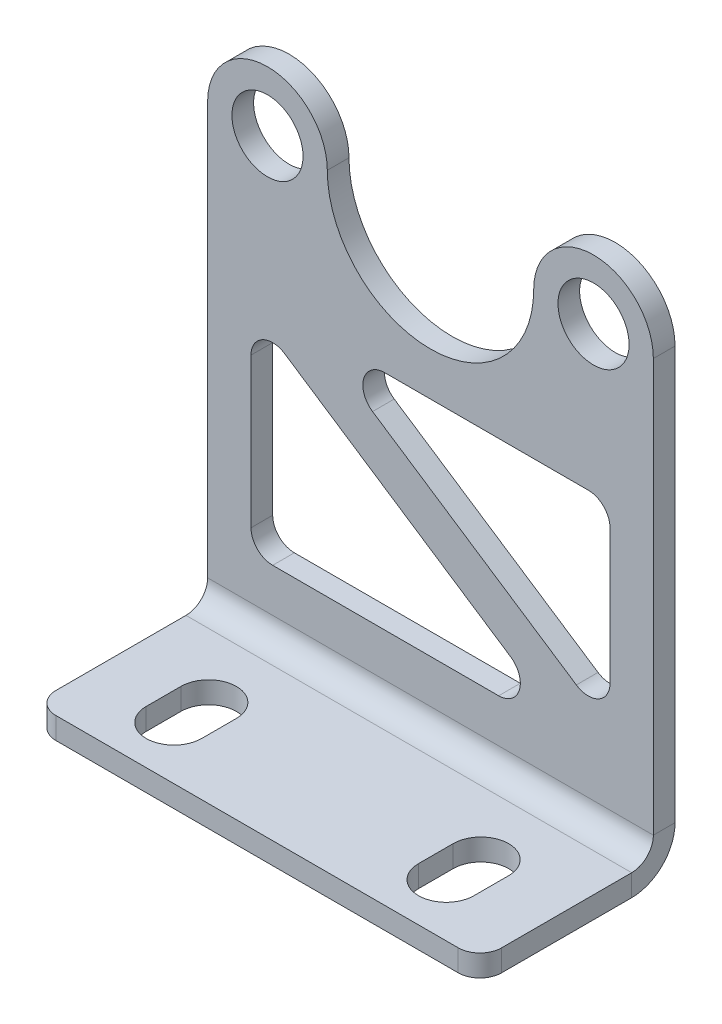
from build123d import *

# Parameters (mm, degrees)
SKETCH1_R              = 5.207
BOSS_EXTRUDE1_DEPTH    = 3.175
SKETCH2_W              = 65.278
SKETCH2_H              = 25.4
BOSS_EXTRUDE2_DEPTH    = 3.175
FILLET1_R              = 3.175
CONVERT_SOLID1_DEPTH   = 65.278
CONVERT_SOLID1_2_DEPTH = 65.278
CUT_EXTRUDE1_DEPTH     = 104.864417073


# Read off the part's stored shape, not the designer's step: Convert-Solid1
with BuildPart() as part:
    # Sketch1 → Boss-Extrude1 (new body)
    with BuildSketch(Plane.XY):
        with BuildLine():
            Line((0, 0), (65.278, 0))
            Line((65.278, 0), (65.278, 66.802))
            ThreePointArc((65.278, 66.802), (56.515, 75.565), (47.752, 66.802))
            ThreePointArc((47.752, 66.802), (32.639, 51.689), (17.526, 66.802))
            ThreePointArc((17.526, 66.802), (8.763, 75.565), (0, 66.802))
            Line((0, 66.802), (0, 0))
        make_face()
        with Locations((8.763, 66.802)):
            Circle(SKETCH1_R, mode=Mode.SUBTRACT)
        with Locations((56.515, 66.802)):
            Circle(SKETCH1_R, mode=Mode.SUBTRACT)
    extrude(amount=BOSS_EXTRUDE1_DEPTH)

    # Sketch2 → Boss-Extrude2 (add)
    with BuildSketch(Plane(origin=(0, 0, 0), x_dir=(1, 0, 0), z_dir=(0, 1, 0))):
        with Locations((32.639, -15.875)):
            Rectangle(SKETCH2_W, SKETCH2_H)
        with BuildLine():
            Line((16.764, -15.73022), (16.764, -20.81022))
            ThreePointArc((16.764, -20.81022), (12.7, -24.87422), (8.636, -20.81022))
            Line((8.636, -20.81022), (8.636, -15.73022))
            ThreePointArc((8.636, -15.73022), (12.7, -11.66622), (16.764, -15.73022))
        make_face(mode=Mode.SUBTRACT)
        with BuildLine():
            Line((48.514, -15.73022), (48.514, -20.81022))
            ThreePointArc((48.514, -20.81022), (52.578, -24.87422), (56.642, -20.81022))
            Line((56.642, -20.81022), (56.642, -15.73022))
            ThreePointArc((56.642, -15.73022), (52.578, -11.66622), (48.514, -15.73022))
        make_face(mode=Mode.SUBTRACT)
    extrude(amount=BOSS_EXTRUDE2_DEPTH)

    # Fillet1
    fillet1_edges = [part.edges().sort_by_distance(p)[0] for p in [
        (0, 1.5875, 28.575),
        (65.278, 1.5875, 28.575),
    ]]
    fillet(fillet1_edges, radius=FILLET1_R)

    # Convert-Solid1 outline → Convert-Solid1 (cut)
    with BuildSketch(Plane.YZ):
        with BuildLine():
            ThreePointArc((6.35, 0), (1.859871939, 1.859871939), (0, 6.35))
            Line((0, 6.35), (0, 0))
            Line((0, 0), (6.35, 0))
        make_face()
    extrude(amount=CONVERT_SOLID1_DEPTH, mode=Mode.SUBTRACT)

    # Convert-Solid1 2 outline → Convert-Solid1 2 (add)
    with BuildSketch(Plane.YZ):
        with BuildLine():
            ThreePointArc((6.35, 3.175), (4.10493597, 4.10493597), (3.175, 6.35))
            Line((3.175, 6.35), (3.175, 3.175))
            Line((3.175, 3.175), (6.35, 3.175))
        make_face()
    extrude(amount=CONVERT_SOLID1_2_DEPTH)

    # Sketch3 → Cut-Extrude1 (cut, through all)
    with BuildSketch(Plane(origin=(0, 0, 0), x_dir=(-1, 0, 0), z_dir=(0, 0, -1))):
        with BuildLine():
            ThreePointArc((-54.001056047, 19.766894808), (-57.256030763, 19.618085357), (-58.928, 22.41478404))
            Line((-58.928, 22.41478404), (-58.928, 42.164))
            ThreePointArc((-58.928, 42.164), (-57.99806403, 44.40906403), (-55.753, 45.339))
            Line((-55.753, 45.339), (-25.904022132, 45.339))
            ThreePointArc((-25.904022132, 45.339), (-22.863654283, 43.078761359), (-24.152078179, 39.516110768))
            Line((-24.152078179, 39.516110768), (-54.001056047, 19.766894808))
        make_face()
        with BuildLine():
            ThreePointArc((-42.621372005, 12.7), (-45.661739854, 14.960238641), (-44.373315958, 18.522889232))
            Line((-44.373315958, 18.522889232), (-11.276943953, 40.42070433))
            ThreePointArc((-11.276943953, 40.42070433), (-8.021969237, 40.569513781), (-6.35, 37.772815098))
            Line((-6.35, 37.772815098), (-6.35, 15.875))
            ThreePointArc((-6.35, 15.875), (-7.27993597, 13.62993597), (-9.525, 12.7))
            Line((-9.525, 12.7), (-42.621372005, 12.7))
        make_face()
    extrude(amount=-CUT_EXTRUDE1_DEPTH, mode=Mode.SUBTRACT)


solid = part.part
